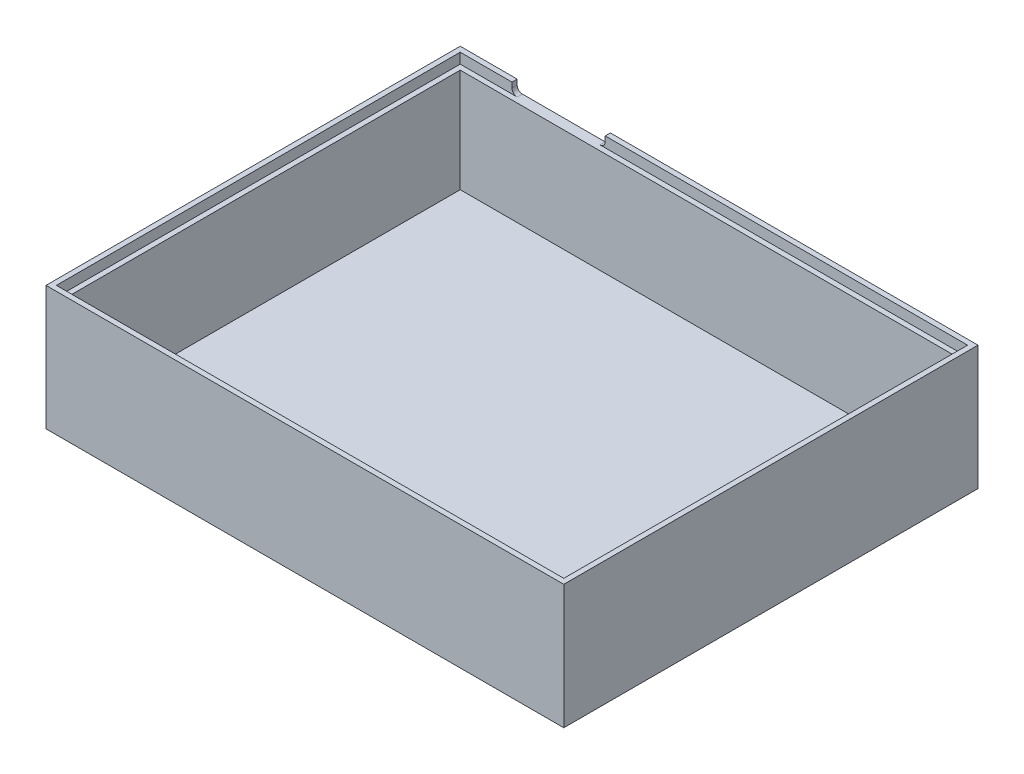
from build123d import *

# Parameters (mm, degrees)
ESQUISSE1_W             = 100
ESQUISSE1_H             = 80
BOSS_EXTRU_1_DEPTH      = 2
ESQUISSE2_W             = 100
ESQUISSE2_H             = 80
ESQUISSE2_W_2           = 96
ESQUISSE2_H_2           = 76
BOSS_EXTRU_2_DEPTH      = 20
ESQUISSE5_W             = 100
ESQUISSE5_H             = 80
ESQUISSE5_W_2           = 98
ESQUISSE5_H_2           = 78
BOSS_EXTRU_3_DEPTH      = 2
ESQUISSE6_W             = 18
ESQUISSE6_H             = 2
ENL_V_MAT_EXTRU_3_DEPTH = 10
CONG_1_R                = 1


with BuildPart() as part:
    # Esquisse1 → Boss.-Extru.1 (new body)
    with BuildSketch(Plane(origin=(0, 0, 0), x_dir=(1, 0, 0), z_dir=(0, 1, 0))):
        Rectangle(ESQUISSE1_W, ESQUISSE1_H)
    extrude(amount=BOSS_EXTRU_1_DEPTH)

    # Esquisse2 → Boss.-Extru.2 (add)
    with BuildSketch(Plane(origin=(0, 2, 0), x_dir=(1, 0, 0), z_dir=(0, 1, 0))):
        Rectangle(ESQUISSE2_W, ESQUISSE2_H)
        Rectangle(ESQUISSE2_W_2, ESQUISSE2_H_2, mode=Mode.SUBTRACT)
    extrude(amount=BOSS_EXTRU_2_DEPTH)

    # Esquisse5 → Boss.-Extru.3 (add)
    with BuildSketch(Plane(origin=(0, 22, 0), x_dir=(1, 0, 0), z_dir=(0, 1, 0))):
        Rectangle(ESQUISSE5_W, ESQUISSE5_H)
        Rectangle(ESQUISSE5_W_2, ESQUISSE5_H_2, mode=Mode.SUBTRACT)
    extrude(amount=BOSS_EXTRU_3_DEPTH)

    # Esquisse6 → Enlèv. mat.-Extru.3 (cut)
    with BuildSketch(Plane(origin=(0, 0, -40), x_dir=(-1, 0, 0), z_dir=(0, 0, -1))):
        with Locations((30, 23)):
            Rectangle(ESQUISSE6_W, ESQUISSE6_H)
    extrude(amount=-ENL_V_MAT_EXTRU_3_DEPTH, mode=Mode.SUBTRACT)

    # Congé1
    cong_1_edges = [part.edges().sort_by_distance(p)[0] for p in [
        (-21, 22, -39.5),
        (-39, 22, -39.5),
    ]]
    fillet(cong_1_edges, radius=CONG_1_R)


solid = part.part
